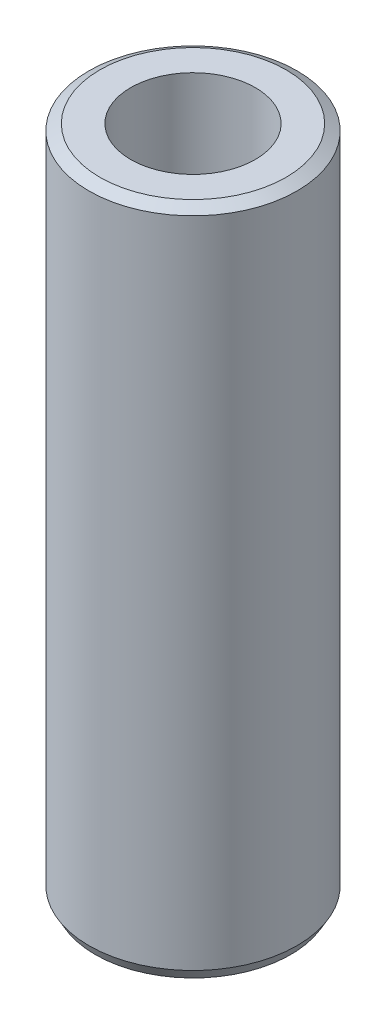
from build123d import *
from OCP.BRepFilletAPI import BRepFilletAPI_MakeChamfer

# Parameters (mm, degrees)
SKETCH1_R           = 7.5
BOSS_EXTRUDE1_DEPTH = 48.340958322
SKETCH2_R           = 4.491639602
CUT_EXTRUDE1_DEPTH  = 50.490890591
CHAMFER1_SIZE       = 0.455971203
CHAMFER1_SIZE2      = 0.78976529


with BuildPart() as part:
    # Sketch1 → Boss-Extrude1 (new body)
    with BuildSketch(Plane(origin=(0, 0, 0), x_dir=(1, 0, 0), z_dir=(0, 1, 0))):
        Circle(SKETCH1_R)
    extrude(amount=BOSS_EXTRUDE1_DEPTH)

    # Sketch2 → Cut-Extrude1 (cut, through all)
    with BuildSketch(Plane(origin=(0, 0, 0), x_dir=(1, 0, 0), z_dir=(0, 1, 0))):
        Circle(SKETCH2_R)
    extrude(amount=CUT_EXTRUDE1_DEPTH, mode=Mode.SUBTRACT)

    # Chamfer1: one chamfer whose edges measure the first distance from different faces: ONE call of the kernel's chamfer builder (chamfer() names one face for all edges)
    chamfer1_edges_1 = [part.edges().sort_by_distance(p)[0] for p in [
        (-7.5, 48.340958322, 0),
    ]]
    chamfer1_side_1 = [part.faces().sort_by_distance(p)[0] for p in [
        (-7.5, 24.170479161, 0),
    ]]
    chamfer1_edges_2 = [part.edges().sort_by_distance(p)[0] for p in [
        (-7.5, 0, 0),
    ]]
    chamfer1_side_2 = [part.faces().sort_by_distance(p)[0] for p in [
        (-7.287867966, 0, 0),
    ]]
    chamfer1 = BRepFilletAPI_MakeChamfer(part.part.solid().wrapped)
    for e in chamfer1_edges_1:
        chamfer1.Add(CHAMFER1_SIZE, CHAMFER1_SIZE2, e.wrapped, chamfer1_side_1[0].wrapped)  # the first distance lies on this face
    for e in chamfer1_edges_2:
        chamfer1.Add(CHAMFER1_SIZE, CHAMFER1_SIZE2, e.wrapped, chamfer1_side_2[0].wrapped)  # the first distance lies on this face
    add(Compound.cast(chamfer1.Shape()), mode=Mode.REPLACE)


solid = part.part
